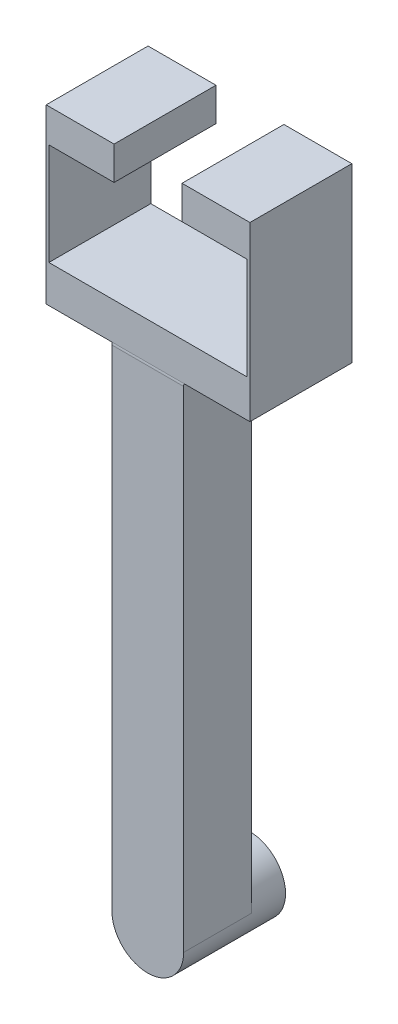
from build123d import *

# Parameters (mm, degrees)
SKETCH2_R           = 13.4112
BOSS_EXTRUDE1_DEPTH = 38.1
SKETCH5_W           = 26.8224
SKETCH5_H           = 184.15
BOSS_EXTRUDE2_DEPTH = 25.4
SKETCH8_W           = 76.2
SKETCH8_H           = 38.1
BOSS_EXTRUDE3_DEPTH = 13.97
SKETCH9_W           = 1.016
SKETCH9_H           = 38.1
BOSS_EXTRUDE4_DEPTH = 38.1
SKETCH10_W          = 25.4
SKETCH10_H          = 38.1
BOSS_EXTRUDE5_DEPTH = 12.446
FILLET1_R           = 3.81


with BuildPart() as part:
    # Sketch2 → Boss-Extrude1 (new body)
    with BuildSketch(Plane.XY):
        with Locations(Location((0, 0, 0), (0, 0, 180))):
            Circle(SKETCH2_R)
    extrude(amount=BOSS_EXTRUDE1_DEPTH)

    # Sketch5 → Boss-Extrude2 (add)
    with BuildSketch(Plane.XY.offset(38.1)):
        with Locations((0, 92.075)):
            Rectangle(SKETCH5_W, SKETCH5_H)
    extrude(amount=-BOSS_EXTRUDE2_DEPTH)

    # Sketch8 → Boss-Extrude3 (add)
    with BuildSketch(Plane(origin=(0, 184.15, 0), x_dir=(1, 0, 0), z_dir=(0, 1, 0))):
        with Locations((0, -18.948214994)):
            Rectangle(SKETCH8_W, SKETCH8_H)
    extrude(amount=BOSS_EXTRUDE3_DEPTH)

    # Sketch9 → Boss-Extrude4 (add)
    with BuildSketch(Plane(origin=(0, 198.12, 0), x_dir=(1, 0, 0), z_dir=(0, 1, 0))):
        with Locations((-37.592, -18.948214994)):
            Rectangle(SKETCH9_W, SKETCH9_H)
        with Locations((37.592, -18.948214994)):
            Rectangle(SKETCH9_W, SKETCH9_H)
    extrude(amount=BOSS_EXTRUDE4_DEPTH)

    # Sketch10 → Boss-Extrude5 (add)
    with BuildSketch(Plane(origin=(0, 236.22, 0), x_dir=(1, 0, 0), z_dir=(0, 1, 0))):
        with Locations((-25.4, -18.948214994)):
            Rectangle(SKETCH10_W, SKETCH10_H)
        with Locations((25.4, -18.948214994)):
            Rectangle(SKETCH10_W, SKETCH10_H)
    extrude(amount=BOSS_EXTRUDE5_DEPTH)

    # Fillet1
    # the kernel refuses this fillet: 3.81 mm, written as the material it takes off along each edge
    with BuildSketch(Plane(origin=(15.598152153, 184.15, 38.1), x_dir=(0, 0, -1), z_dir=(-1, 0, 0))) as fillet1_piece_1:
        with BuildLine():
            CenterArc((3.81, 0.874780861), FILLET1_R, 180, 13.273598337)
            Line((0, 0.874780861), (-0.0762, 0.874780861))
            Line((-0.0762, 0.874780861), (-0.0762, 0))
            Line((-0.0762, 0), (0, -0.0762))
            ThreePointArc((0, -0.0762), (0.050892503, -0.0762), (0.027620706, -0.017495617))
            Line((0.027620706, -0.017495617), (0.101785006, 0))
        make_face()
    extrude(amount=31.196304306, mode=Mode.SUBTRACT)


solid = part.part
